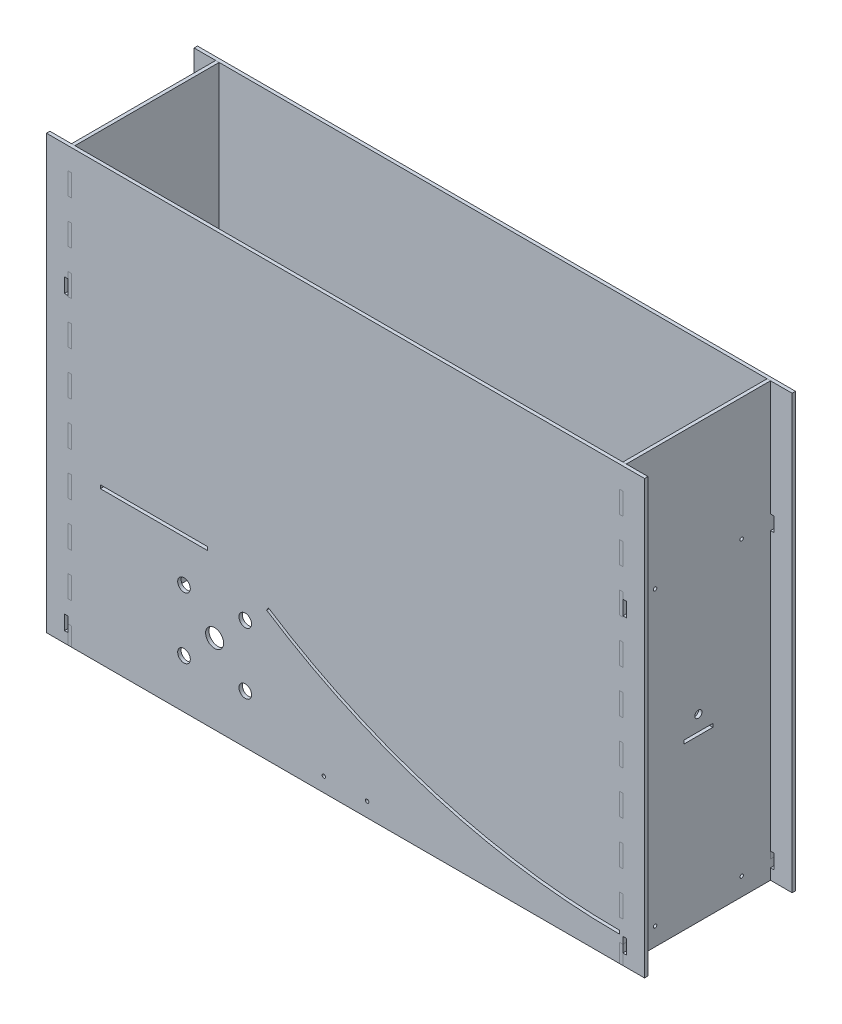
from build123d import *

# Parameters (mm, degrees)
SKETCH1_W                      = 488.5944
SKETCH1_H                      = 132.9944
SKETCH1_W_2                    = 482.6
SKETCH1_H_2                    = 127
BASE_EXTRUDE_DEPTH             = 2.9972
SKETCH1_3_W                    = 488.5944
SKETCH1_3_H                    = 132.9944
SKETCH1_3_W_2                  = 482.6
SKETCH1_3_H_2                  = 127
WALL_EXTRUDE_DEPTH             = 383.9972
WHEELRAMP_R                    = 7.937499998
WHEELRAMP_R_2                  = 5.556249998
WHEELRAMP_W                    = 94.294688084
WHEELRAMP_H                    = 2.9972
CUT_EXTRUDE9_DEPTH             = 475.154491666
SKETCH19_W                     = 25.4
SKETCH19_H                     = 2.9972
SKETCH19_R                     = 3.175
SIDE_CUTS_DEPTH                = 625.980171627
SKETCH23_W                     = 19.05
SKETCH23_H                     = 383.9972
BOSS_EXTRUDE1_DEPTH            = 2.9972
BOSS_EXTRUDE2_START            = -132.9944
SKETCH23_2_W                   = 19.05
SKETCH23_2_H                   = 383.9972
BOSS_EXTRUDE2_DEPTH            = 2.9972
SKETCH21_W                     = 12.827
SKETCH21_H                     = 6.477
SKETCH21_W_2                   = 6.477
SKETCH21_H_2                   = 12.827
SKETCH21_W_3                   = 3.175
BOTTOM_SUPPORT_HOLES_DEPTH     = 471.348248603
SPLIT1_START                   = -244.2972
SPLIT1_OUTLINE_W               = 2.9972
SPLIT1_OUTLINE_H               = 25.4
SPLIT1_OUTLINE_R               = 3.175
SPLIT1_DEPTH                   = 2.9972
SPLIT1_START_2                 = 2.9972
SPLIT1_2_OUTLINE_W             = 2.9972
SPLIT1_2_OUTLINE_H             = 127
SPLIT1_2_DEPTH                 = 381
SPLIT1_3_OUTLINE_W             = 2.9972
SPLIT1_3_OUTLINE_H             = 12.0904
SPLIT1_3_DEPTH                 = 19.19986
SPLIT1_START_3                 = 38.39972
SPLIT1_4_OUTLINE_W             = 2.9972
SPLIT1_4_OUTLINE_H             = 2.9972
SPLIT1_4_DEPTH                 = 19.19986
SPLIT1_START_4                 = 76.79944
SPLIT1_5_OUTLINE_W             = 2.9972
SPLIT1_5_OUTLINE_H             = 2.9972
SPLIT1_5_DEPTH                 = 19.19986
SPLIT1_START_5                 = 115.19916
SPLIT1_6_OUTLINE_W             = 2.9972
SPLIT1_6_OUTLINE_H             = 2.9972
SPLIT1_6_DEPTH                 = 19.19986
SPLIT1_START_6                 = 153.59888
SPLIT1_7_OUTLINE_W             = 2.9972
SPLIT1_7_OUTLINE_H             = 2.9972
SPLIT1_7_DEPTH                 = 19.19986
SPLIT1_START_7                 = 191.9986
SPLIT1_8_OUTLINE_W             = 2.9972
SPLIT1_8_OUTLINE_H             = 2.9972
SPLIT1_8_DEPTH                 = 19.19986
SPLIT1_START_8                 = 230.39832
SPLIT1_9_OUTLINE_W             = 2.9972
SPLIT1_9_OUTLINE_H             = 2.9972
SPLIT1_9_DEPTH                 = 19.19986
SPLIT1_START_9                 = 268.79804
SPLIT1_10_OUTLINE_W            = 2.9972
SPLIT1_10_OUTLINE_H            = 2.9972
SPLIT1_10_DEPTH                = 19.19986
SPLIT1_START_10                = 307.19776
SPLIT1_11_OUTLINE_W            = 2.9972
SPLIT1_11_OUTLINE_H            = 2.9972
SPLIT1_11_DEPTH                = 19.19986
SPLIT1_START_11                = 345.59748
SPLIT1_12_OUTLINE_W            = 2.9972
SPLIT1_12_OUTLINE_H            = 2.9972
SPLIT1_12_DEPTH                = 19.19986
SPLIT2_START                   = 241.3
SPLIT2_OUTLINE_W               = 2.9972
SPLIT2_OUTLINE_H               = 25.4
SPLIT2_OUTLINE_R               = 3.175
SPLIT2_DEPTH                   = 2.9972
SPLIT2_START_2                 = 2.9972
SPLIT2_2_OUTLINE_W             = 2.9972
SPLIT2_2_OUTLINE_H             = 127
SPLIT2_2_DEPTH                 = 381
SPLIT2_3_OUTLINE_W             = 2.9972
SPLIT2_3_OUTLINE_H             = 12.0904
SPLIT2_3_DEPTH                 = 19.19986
SPLIT2_START_3                 = 38.39972
SPLIT2_4_OUTLINE_W             = 2.9972
SPLIT2_4_OUTLINE_H             = 2.9972
SPLIT2_4_DEPTH                 = 19.19986
SPLIT2_START_4                 = 76.79944
SPLIT2_5_OUTLINE_W             = 2.9972
SPLIT2_5_OUTLINE_H             = 2.9972
SPLIT2_5_DEPTH                 = 19.19986
SPLIT2_START_5                 = 115.19916
SPLIT2_6_OUTLINE_W             = 2.9972
SPLIT2_6_OUTLINE_H             = 2.9972
SPLIT2_6_DEPTH                 = 19.19986
SPLIT2_START_6                 = 153.59888
SPLIT2_7_OUTLINE_W             = 2.9972
SPLIT2_7_OUTLINE_H             = 2.9972
SPLIT2_7_DEPTH                 = 19.19986
SPLIT2_START_7                 = 191.9986
SPLIT2_8_OUTLINE_W             = 2.9972
SPLIT2_8_OUTLINE_H             = 2.9972
SPLIT2_8_DEPTH                 = 19.19986
SPLIT2_START_8                 = 230.39832
SPLIT2_9_OUTLINE_W             = 2.9972
SPLIT2_9_OUTLINE_H             = 2.9972
SPLIT2_9_DEPTH                 = 19.19986
SPLIT2_START_9                 = 268.79804
SPLIT2_10_OUTLINE_W            = 2.9972
SPLIT2_10_OUTLINE_H            = 2.9972
SPLIT2_10_DEPTH                = 19.19986
SPLIT2_START_10                = 307.19776
SPLIT2_11_OUTLINE_W            = 2.9972
SPLIT2_11_OUTLINE_H            = 2.9972
SPLIT2_11_DEPTH                = 19.19986
SPLIT2_START_11                = 345.59748
SPLIT2_12_OUTLINE_W            = 2.9972
SPLIT2_12_OUTLINE_H            = 2.9972
SPLIT2_12_DEPTH                = 19.19986
SKETCH22_W                     = 526.6944
SKETCH22_H                     = 2.9972
CUT_EXTRUDE5_DEPTH             = 485.24488411
SKETCH26_R                     = 1.5
SKETCH26_W                     = 3.175
SKETCH26_H                     = 12.7
FRONT_BACK_SUPPORT_HOLES_DEPTH = 485.24488411
SKETCH27_R                     = 1.5
SIDE_SUPPORT_HOLES_DEPTH       = 640.983252958


# Read off the part's stored shape, not the designer's step: Split1, Split2
with BuildPart() as part:
    # Sketch1 → Base Extrude (new body)
    # profile 1 of 2: a face of its own
    with BuildSketch(Plane(origin=(0, 0, 0), x_dir=(1, 0, 0), z_dir=(0, 1, 0))):
        Rectangle(SKETCH1_W, SKETCH1_H)
        Rectangle(SKETCH1_W_2, SKETCH1_H_2, mode=Mode.SUBTRACT)
    # profile 2 of 2: a face of its own
    with BuildSketch(Plane(origin=(0, 0, 0), x_dir=(1, 0, 0), z_dir=(0, 1, 0))):
        Rectangle(SKETCH1_W_2, SKETCH1_H_2)
    extrude(amount=BASE_EXTRUDE_DEPTH)

    # Sketch1<3> → Wall Extrude (add)
    with BuildSketch(Plane(origin=(0, 0, 0), x_dir=(1, 0, 0), z_dir=(0, 1, 0))):
        Rectangle(SKETCH1_3_W, SKETCH1_3_H)
        Rectangle(SKETCH1_3_W_2, SKETCH1_3_H_2, mode=Mode.SUBTRACT)
    extrude(amount=WALL_EXTRUDE_DEPTH)

    # WheelRamp → Cut-Extrude9 (cut, through all)
    with BuildSketch(Plane.XY.offset(66.4972)):
        with Locations((-115.255311916, 72.974199998)):
            Circle(WHEELRAMP_R)
        with Locations((-142.242811916, 99.961699998)):
            Circle(WHEELRAMP_R_2)
        with Locations((-88.267811916, 99.961699998)):
            Circle(WHEELRAMP_R_2)
        with Locations((-88.267811916, 45.986699998)):
            Circle(WHEELRAMP_R_2)
        with Locations((-142.242811916, 45.986699998)):
            Circle(WHEELRAMP_R_2)
        with Locations((-168.752655958, 138.099799997)):
            Rectangle(WHEELRAMP_W, WHEELRAMP_H)
        with BuildLine():
            ThreePointArc((241.3, 25.4), (79.286857825, 48.817031678), (-69.464743824, 117.151332121))
            Line((-69.464743824, 117.151332121), (-67.836837693, 119.667903095))
            ThreePointArc((-67.836837693, 119.667903095), (80.135545434, 51.691564193), (241.3, 28.3972))
            Line((241.3, 28.3972), (241.3, 25.4))
        make_face()
    extrude(amount=-CUT_EXTRUDE9_DEPTH, mode=Mode.SUBTRACT)

    # Sketch19 → Side Cuts (cut, through all)
    with BuildSketch(Plane.ZY.offset(244.2972)):
        with Locations((0, 146.5326)):
            Rectangle(SKETCH19_W, SKETCH19_H)
        with Locations((0, 161.4932)):
            Circle(SKETCH19_R)
    extrude(amount=-SIDE_CUTS_DEPTH, mode=Mode.SUBTRACT)

    # Sketch23 → Boss-Extrude1 (add)
    with BuildSketch(Plane.XY.offset(66.4972)):
        with Locations((-253.8222, 191.9986)):
            Rectangle(SKETCH23_W, SKETCH23_H)
        with Locations((253.8222, 191.9986)):
            Rectangle(SKETCH23_W, SKETCH23_H)
    extrude(amount=-BOSS_EXTRUDE1_DEPTH)

    # Sketch23<2> → Boss-Extrude2 (add)
    with BuildSketch(Plane.XY.offset(66.4972).offset(BOSS_EXTRUDE2_START)):
        with Locations((-253.8222, 191.9986)):
            Rectangle(SKETCH23_2_W, SKETCH23_2_H)
        with Locations((253.8222, 191.9986)):
            Rectangle(SKETCH23_2_W, SKETCH23_2_H)
    extrude(amount=BOSS_EXTRUDE2_DEPTH)

    # Sketch21 → Bottom Support Holes (cut, through all)
    with BuildSketch(Plane.XZ):
        with Locations((0, 50.5587)):
            Rectangle(SKETCH21_W, SKETCH21_H)
        with Locations((-228.3587, 0)):
            Rectangle(SKETCH21_W_2, SKETCH21_H_2)
        with Locations((0, -50.5587)):
            Rectangle(SKETCH21_W, SKETCH21_H)
        with Locations((230.0097, 0)):
            Rectangle(SKETCH21_W_3, SKETCH21_H_2)
    extrude(amount=-BOTTOM_SUPPORT_HOLES_DEPTH, mode=Mode.SUBTRACT)

    # Split1 2 outline → Split1 2 (cut)
    with BuildSketch(Plane(origin=(0, 0, 0), x_dir=(1, 0, 0), z_dir=(0, 1, 0)).offset(SPLIT1_START_2)):
        with Locations((-242.7986, 0)):
            Rectangle(SPLIT1_2_OUTLINE_W, SPLIT1_2_OUTLINE_H)
    extrude(amount=SPLIT1_2_DEPTH, mode=Mode.SUBTRACT)

    # Split1 3 outline → Split1 3 (cut)
    with BuildSketch(Plane(origin=(0, 0, 0), x_dir=(1, 0, 0), z_dir=(0, 1, 0))):
        with Locations((-242.7986, 60.452)):
            Rectangle(SPLIT1_3_OUTLINE_W, SPLIT1_3_OUTLINE_H)
        with Locations((-242.7986, 36.2712)):
            Rectangle(SPLIT1_3_OUTLINE_W, SPLIT1_3_OUTLINE_H)
        with Locations((-242.7986, 12.0904)):
            Rectangle(SPLIT1_3_OUTLINE_W, SPLIT1_3_OUTLINE_H)
        with Locations((-242.7986, -12.0904)):
            Rectangle(SPLIT1_3_OUTLINE_W, SPLIT1_3_OUTLINE_H)
        with Locations((-242.7986, -36.2712)):
            Rectangle(SPLIT1_3_OUTLINE_W, SPLIT1_3_OUTLINE_H)
        with Locations((-242.7986, -60.452)):
            Rectangle(SPLIT1_3_OUTLINE_W, SPLIT1_3_OUTLINE_H)
    extrude(amount=SPLIT1_3_DEPTH, mode=Mode.SUBTRACT)

    # Split1 4 outline → Split1 4 (cut)
    with BuildSketch(Plane(origin=(0, 0, 0), x_dir=(1, 0, 0), z_dir=(0, 1, 0)).offset(SPLIT1_START_3)):
        with Locations((-242.7986, 64.9986)):
            Rectangle(SPLIT1_4_OUTLINE_W, SPLIT1_4_OUTLINE_H)
        with Locations((-242.7986, -64.9986)):
            Rectangle(SPLIT1_4_OUTLINE_W, SPLIT1_4_OUTLINE_H)
    extrude(amount=SPLIT1_4_DEPTH, mode=Mode.SUBTRACT)

    # Split1 5 outline → Split1 5 (cut)
    with BuildSketch(Plane(origin=(0, 0, 0), x_dir=(1, 0, 0), z_dir=(0, 1, 0)).offset(SPLIT1_START_4)):
        with Locations((-242.7986, 64.9986)):
            Rectangle(SPLIT1_5_OUTLINE_W, SPLIT1_5_OUTLINE_H)
        with Locations((-242.7986, -64.9986)):
            Rectangle(SPLIT1_5_OUTLINE_W, SPLIT1_5_OUTLINE_H)
    extrude(amount=SPLIT1_5_DEPTH, mode=Mode.SUBTRACT)

    # Split1 6 outline → Split1 6 (cut)
    with BuildSketch(Plane(origin=(0, 0, 0), x_dir=(1, 0, 0), z_dir=(0, 1, 0)).offset(SPLIT1_START_5)):
        with Locations((-242.7986, 64.9986)):
            Rectangle(SPLIT1_6_OUTLINE_W, SPLIT1_6_OUTLINE_H)
        with Locations((-242.7986, -64.9986)):
            Rectangle(SPLIT1_6_OUTLINE_W, SPLIT1_6_OUTLINE_H)
    extrude(amount=SPLIT1_6_DEPTH, mode=Mode.SUBTRACT)

    # Split1 7 outline → Split1 7 (cut)
    with BuildSketch(Plane(origin=(0, 0, 0), x_dir=(1, 0, 0), z_dir=(0, 1, 0)).offset(SPLIT1_START_6)):
        with Locations((-242.7986, 64.9986)):
            Rectangle(SPLIT1_7_OUTLINE_W, SPLIT1_7_OUTLINE_H)
        with Locations((-242.7986, -64.9986)):
            Rectangle(SPLIT1_7_OUTLINE_W, SPLIT1_7_OUTLINE_H)
    extrude(amount=SPLIT1_7_DEPTH, mode=Mode.SUBTRACT)

    # Split1 8 outline → Split1 8 (cut)
    with BuildSketch(Plane(origin=(0, 0, 0), x_dir=(1, 0, 0), z_dir=(0, 1, 0)).offset(SPLIT1_START_7)):
        with Locations((-242.7986, 64.9986)):
            Rectangle(SPLIT1_8_OUTLINE_W, SPLIT1_8_OUTLINE_H)
        with Locations((-242.7986, -64.9986)):
            Rectangle(SPLIT1_8_OUTLINE_W, SPLIT1_8_OUTLINE_H)
    extrude(amount=SPLIT1_8_DEPTH, mode=Mode.SUBTRACT)

    # Split1 9 outline → Split1 9 (cut)
    with BuildSketch(Plane(origin=(0, 0, 0), x_dir=(1, 0, 0), z_dir=(0, 1, 0)).offset(SPLIT1_START_8)):
        with Locations((-242.7986, 64.9986)):
            Rectangle(SPLIT1_9_OUTLINE_W, SPLIT1_9_OUTLINE_H)
        with Locations((-242.7986, -64.9986)):
            Rectangle(SPLIT1_9_OUTLINE_W, SPLIT1_9_OUTLINE_H)
    extrude(amount=SPLIT1_9_DEPTH, mode=Mode.SUBTRACT)

    # Split1 10 outline → Split1 10 (cut)
    with BuildSketch(Plane(origin=(0, 0, 0), x_dir=(1, 0, 0), z_dir=(0, 1, 0)).offset(SPLIT1_START_9)):
        with Locations((-242.7986, 64.9986)):
            Rectangle(SPLIT1_10_OUTLINE_W, SPLIT1_10_OUTLINE_H)
        with Locations((-242.7986, -64.9986)):
            Rectangle(SPLIT1_10_OUTLINE_W, SPLIT1_10_OUTLINE_H)
    extrude(amount=SPLIT1_10_DEPTH, mode=Mode.SUBTRACT)

    # Split1 11 outline → Split1 11 (cut)
    with BuildSketch(Plane(origin=(0, 0, 0), x_dir=(1, 0, 0), z_dir=(0, 1, 0)).offset(SPLIT1_START_10)):
        with Locations((-242.7986, 64.9986)):
            Rectangle(SPLIT1_11_OUTLINE_W, SPLIT1_11_OUTLINE_H)
        with Locations((-242.7986, -64.9986)):
            Rectangle(SPLIT1_11_OUTLINE_W, SPLIT1_11_OUTLINE_H)
    extrude(amount=SPLIT1_11_DEPTH, mode=Mode.SUBTRACT)

    # Split1 12 outline → Split1 12 (cut)
    with BuildSketch(Plane(origin=(0, 0, 0), x_dir=(1, 0, 0), z_dir=(0, 1, 0)).offset(SPLIT1_START_11)):
        with Locations((-242.7986, 64.9986)):
            Rectangle(SPLIT1_12_OUTLINE_W, SPLIT1_12_OUTLINE_H)
        with Locations((-242.7986, -64.9986)):
            Rectangle(SPLIT1_12_OUTLINE_W, SPLIT1_12_OUTLINE_H)
    extrude(amount=SPLIT1_12_DEPTH, mode=Mode.SUBTRACT)

    # Split2 2 outline → Split2 2 (cut)
    with BuildSketch(Plane(origin=(0, 0, 0), x_dir=(1, 0, 0), z_dir=(0, 1, 0)).offset(SPLIT2_START_2)):
        with Locations((242.7986, 0)):
            Rectangle(SPLIT2_2_OUTLINE_W, SPLIT2_2_OUTLINE_H)
    extrude(amount=SPLIT2_2_DEPTH, mode=Mode.SUBTRACT)

    # Split2 3 outline → Split2 3 (cut)
    with BuildSketch(Plane(origin=(0, 0, 0), x_dir=(1, 0, 0), z_dir=(0, 1, 0))):
        with Locations((242.7986, 60.452)):
            Rectangle(SPLIT2_3_OUTLINE_W, SPLIT2_3_OUTLINE_H)
        with Locations((242.7986, 36.2712)):
            Rectangle(SPLIT2_3_OUTLINE_W, SPLIT2_3_OUTLINE_H)
        with Locations((242.7986, 12.0904)):
            Rectangle(SPLIT2_3_OUTLINE_W, SPLIT2_3_OUTLINE_H)
        with Locations((242.7986, -12.0904)):
            Rectangle(SPLIT2_3_OUTLINE_W, SPLIT2_3_OUTLINE_H)
        with Locations((242.7986, -36.2712)):
            Rectangle(SPLIT2_3_OUTLINE_W, SPLIT2_3_OUTLINE_H)
        with Locations((242.7986, -60.452)):
            Rectangle(SPLIT2_3_OUTLINE_W, SPLIT2_3_OUTLINE_H)
    extrude(amount=SPLIT2_3_DEPTH, mode=Mode.SUBTRACT)

    # Split2 4 outline → Split2 4 (cut)
    with BuildSketch(Plane(origin=(0, 0, 0), x_dir=(1, 0, 0), z_dir=(0, 1, 0)).offset(SPLIT2_START_3)):
        with Locations((242.7986, 64.9986)):
            Rectangle(SPLIT2_4_OUTLINE_W, SPLIT2_4_OUTLINE_H)
        with Locations((242.7986, -64.9986)):
            Rectangle(SPLIT2_4_OUTLINE_W, SPLIT2_4_OUTLINE_H)
    extrude(amount=SPLIT2_4_DEPTH, mode=Mode.SUBTRACT)

    # Split2 5 outline → Split2 5 (cut)
    with BuildSketch(Plane(origin=(0, 0, 0), x_dir=(1, 0, 0), z_dir=(0, 1, 0)).offset(SPLIT2_START_4)):
        with Locations((242.7986, 64.9986)):
            Rectangle(SPLIT2_5_OUTLINE_W, SPLIT2_5_OUTLINE_H)
        with Locations((242.7986, -64.9986)):
            Rectangle(SPLIT2_5_OUTLINE_W, SPLIT2_5_OUTLINE_H)
    extrude(amount=SPLIT2_5_DEPTH, mode=Mode.SUBTRACT)

    # Split2 6 outline → Split2 6 (cut)
    with BuildSketch(Plane(origin=(0, 0, 0), x_dir=(1, 0, 0), z_dir=(0, 1, 0)).offset(SPLIT2_START_5)):
        with Locations((242.7986, 64.9986)):
            Rectangle(SPLIT2_6_OUTLINE_W, SPLIT2_6_OUTLINE_H)
        with Locations((242.7986, -64.9986)):
            Rectangle(SPLIT2_6_OUTLINE_W, SPLIT2_6_OUTLINE_H)
    extrude(amount=SPLIT2_6_DEPTH, mode=Mode.SUBTRACT)

    # Split2 7 outline → Split2 7 (cut)
    with BuildSketch(Plane(origin=(0, 0, 0), x_dir=(1, 0, 0), z_dir=(0, 1, 0)).offset(SPLIT2_START_6)):
        with Locations((242.7986, 64.9986)):
            Rectangle(SPLIT2_7_OUTLINE_W, SPLIT2_7_OUTLINE_H)
        with Locations((242.7986, -64.9986)):
            Rectangle(SPLIT2_7_OUTLINE_W, SPLIT2_7_OUTLINE_H)
    extrude(amount=SPLIT2_7_DEPTH, mode=Mode.SUBTRACT)

    # Split2 8 outline → Split2 8 (cut)
    with BuildSketch(Plane(origin=(0, 0, 0), x_dir=(1, 0, 0), z_dir=(0, 1, 0)).offset(SPLIT2_START_7)):
        with Locations((242.7986, 64.9986)):
            Rectangle(SPLIT2_8_OUTLINE_W, SPLIT2_8_OUTLINE_H)
        with Locations((242.7986, -64.9986)):
            Rectangle(SPLIT2_8_OUTLINE_W, SPLIT2_8_OUTLINE_H)
    extrude(amount=SPLIT2_8_DEPTH, mode=Mode.SUBTRACT)

    # Split2 9 outline → Split2 9 (cut)
    with BuildSketch(Plane(origin=(0, 0, 0), x_dir=(1, 0, 0), z_dir=(0, 1, 0)).offset(SPLIT2_START_8)):
        with Locations((242.7986, 64.9986)):
            Rectangle(SPLIT2_9_OUTLINE_W, SPLIT2_9_OUTLINE_H)
        with Locations((242.7986, -64.9986)):
            Rectangle(SPLIT2_9_OUTLINE_W, SPLIT2_9_OUTLINE_H)
    extrude(amount=SPLIT2_9_DEPTH, mode=Mode.SUBTRACT)

    # Split2 10 outline → Split2 10 (cut)
    with BuildSketch(Plane(origin=(0, 0, 0), x_dir=(1, 0, 0), z_dir=(0, 1, 0)).offset(SPLIT2_START_9)):
        with Locations((242.7986, 64.9986)):
            Rectangle(SPLIT2_10_OUTLINE_W, SPLIT2_10_OUTLINE_H)
        with Locations((242.7986, -64.9986)):
            Rectangle(SPLIT2_10_OUTLINE_W, SPLIT2_10_OUTLINE_H)
    extrude(amount=SPLIT2_10_DEPTH, mode=Mode.SUBTRACT)

    # Split2 11 outline → Split2 11 (cut)
    with BuildSketch(Plane(origin=(0, 0, 0), x_dir=(1, 0, 0), z_dir=(0, 1, 0)).offset(SPLIT2_START_10)):
        with Locations((242.7986, 64.9986)):
            Rectangle(SPLIT2_11_OUTLINE_W, SPLIT2_11_OUTLINE_H)
        with Locations((242.7986, -64.9986)):
            Rectangle(SPLIT2_11_OUTLINE_W, SPLIT2_11_OUTLINE_H)
    extrude(amount=SPLIT2_11_DEPTH, mode=Mode.SUBTRACT)

    # Split2 12 outline → Split2 12 (cut)
    with BuildSketch(Plane(origin=(0, 0, 0), x_dir=(1, 0, 0), z_dir=(0, 1, 0)).offset(SPLIT2_START_11)):
        with Locations((242.7986, 64.9986)):
            Rectangle(SPLIT2_12_OUTLINE_W, SPLIT2_12_OUTLINE_H)
        with Locations((242.7986, -64.9986)):
            Rectangle(SPLIT2_12_OUTLINE_W, SPLIT2_12_OUTLINE_H)
    extrude(amount=SPLIT2_12_DEPTH, mode=Mode.SUBTRACT)


with BuildPart() as body_2:
    # Split1 outline → Split1 (new body)
    with BuildSketch(Plane.YZ.offset(SPLIT1_START)):
        Polygon((38.39972, 63.5), (19.19986, 63.5), (19.19986, 66.4972), (0, 66.4972), (0, 54.4068), (2.9972, 54.4068), (2.9972, 42.3164), (0, 42.3164), (0, 30.226), (2.9972, 30.226), (2.9972, 18.1356), (0, 18.1356), (0, 6.0452), (2.9972, 6.0452), (2.9972, -6.0452), (0, -6.0452), (0, -18.1356), (2.9972, -18.1356), (2.9972, -30.226), (0, -30.226), (0, -42.3164), (2.9972, -42.3164), (2.9972, -54.4068), (0, -54.4068), (0, -66.4972), (19.19986, -66.4972), (19.19986, -63.5), (38.39972, -63.5), (38.39972, -66.4972), (57.59958, -66.4972), (57.59958, -63.5), (76.79944, -63.5), (76.79944, -66.4972), (95.9993, -66.4972), (95.9993, -63.5), (115.19916, -63.5), (115.19916, -66.4972), (134.39902, -66.4972), (134.39902, -63.5), (153.59888, -63.5), (153.59888, -66.4972), (172.79874, -66.4972), (172.79874, -63.5), (191.9986, -63.5), (191.9986, -66.4972), (211.19846, -66.4972), (211.19846, -63.5), (230.39832, -63.5), (230.39832, -66.4972), (249.59818, -66.4972), (249.59818, -63.5), (268.79804, -63.5), (268.79804, -66.4972), (287.9979, -66.4972), (287.9979, -63.5), (307.19776, -63.5), (307.19776, -66.4972), (326.39762, -66.4972), (326.39762, -63.5), (345.59748, -63.5), (345.59748, -66.4972), (364.79734, -66.4972), (364.79734, -63.5), (383.9972, -63.5), (383.9972, 63.5), (364.79734, 63.5), (364.79734, 66.4972), (345.59748, 66.4972), (345.59748, 63.5), (326.39762, 63.5), (326.39762, 66.4972), (307.19776, 66.4972), (307.19776, 63.5), (287.9979, 63.5), (287.9979, 66.4972), (268.79804, 66.4972), (268.79804, 63.5), (249.59818, 63.5), (249.59818, 66.4972), (230.39832, 66.4972), (230.39832, 63.5), (211.19846, 63.5), (211.19846, 66.4972), (191.9986, 66.4972), (191.9986, 63.5), (172.79874, 63.5), (172.79874, 66.4972), (153.59888, 66.4972), (153.59888, 63.5), (134.39902, 63.5), (134.39902, 66.4972), (115.19916, 66.4972), (115.19916, 63.5), (95.9993, 63.5), (95.9993, 66.4972), (76.79944, 66.4972), (76.79944, 63.5), (57.59958, 63.5), (57.59958, 66.4972), (38.39972, 66.4972), align=None)
        with Locations((146.5326, 0)):
            Rectangle(SPLIT1_OUTLINE_W, SPLIT1_OUTLINE_H, mode=Mode.SUBTRACT)
        with Locations((161.4932, 0)):
            Circle(SPLIT1_OUTLINE_R, mode=Mode.SUBTRACT)
    extrude(amount=SPLIT1_DEPTH)


with BuildPart() as body_3:
    # Split2 outline → Split2 (new body)
    with BuildSketch(Plane.YZ.offset(SPLIT2_START)):
        Polygon((383.9972, 63.5), (364.79734, 63.5), (364.79734, 66.4972), (345.59748, 66.4972), (345.59748, 63.5), (326.39762, 63.5), (326.39762, 66.4972), (307.19776, 66.4972), (307.19776, 63.5), (287.9979, 63.5), (287.9979, 66.4972), (268.79804, 66.4972), (268.79804, 63.5), (249.59818, 63.5), (249.59818, 66.4972), (230.39832, 66.4972), (230.39832, 63.5), (211.19846, 63.5), (211.19846, 66.4972), (191.9986, 66.4972), (191.9986, 63.5), (172.79874, 63.5), (172.79874, 66.4972), (153.59888, 66.4972), (153.59888, 63.5), (134.39902, 63.5), (134.39902, 66.4972), (115.19916, 66.4972), (115.19916, 63.5), (95.9993, 63.5), (95.9993, 66.4972), (76.79944, 66.4972), (76.79944, 63.5), (57.59958, 63.5), (57.59958, 66.4972), (38.39972, 66.4972), (38.39972, 63.5), (19.19986, 63.5), (19.19986, 66.4972), (0, 66.4972), (0, 54.4068), (2.9972, 54.4068), (2.9972, 42.3164), (0, 42.3164), (0, 30.226), (2.9972, 30.226), (2.9972, 18.1356), (0, 18.1356), (0, 6.0452), (2.9972, 6.0452), (2.9972, -6.0452), (0, -6.0452), (0, -18.1356), (2.9972, -18.1356), (2.9972, -30.226), (0, -30.226), (0, -42.3164), (2.9972, -42.3164), (2.9972, -54.4068), (0, -54.4068), (0, -66.4972), (19.19986, -66.4972), (19.19986, -63.5), (38.39972, -63.5), (38.39972, -66.4972), (57.59958, -66.4972), (57.59958, -63.5), (76.79944, -63.5), (76.79944, -66.4972), (95.9993, -66.4972), (95.9993, -63.5), (115.19916, -63.5), (115.19916, -66.4972), (134.39902, -66.4972), (134.39902, -63.5), (153.59888, -63.5), (153.59888, -66.4972), (172.79874, -66.4972), (172.79874, -63.5), (191.9986, -63.5), (191.9986, -66.4972), (211.19846, -66.4972), (211.19846, -63.5), (230.39832, -63.5), (230.39832, -66.4972), (249.59818, -66.4972), (249.59818, -63.5), (268.79804, -63.5), (268.79804, -66.4972), (287.9979, -66.4972), (287.9979, -63.5), (307.19776, -63.5), (307.19776, -66.4972), (326.39762, -66.4972), (326.39762, -63.5), (345.59748, -63.5), (345.59748, -66.4972), (364.79734, -66.4972), (364.79734, -63.5), (383.9972, -63.5), align=None)
        with Locations((146.5326, 0)):
            Rectangle(SPLIT2_OUTLINE_W, SPLIT2_OUTLINE_H, mode=Mode.SUBTRACT)
        with Locations((161.4932, 0)):
            Circle(SPLIT2_OUTLINE_R, mode=Mode.SUBTRACT)
    extrude(amount=SPLIT2_DEPTH)


with BuildPart() as cut_extrude5_tool:
    # Sketch22 → Cut-Extrude5 (new, through all)
    with BuildSketch(Plane.XY.offset(66.4972)):
        with Locations((0, 1.4986)):
            Rectangle(SKETCH22_W, SKETCH22_H)
    extrude(amount=-CUT_EXTRUDE5_DEPTH)


with BuildPart() as part_1:
    add(part.part)

    # Cut-Extrude5: cut by cut_extrude5_tool
    add(cut_extrude5_tool.part, mode=Mode.SUBTRACT)

    # Sketch26 → Front/Back Support Holes (cut, through all)
    with BuildSketch(Plane.XY.offset(66.4972)):
        with Locations((-19.05, 15.6972)):
            Circle(SKETCH26_R)
        with Locations((19.05, 15.6972)):
            Circle(SKETCH26_R)
        with Locations((245.8847, 18.8722)):
            Rectangle(SKETCH26_W, SKETCH26_H)
        with Locations((-245.8847, 18.8722)):
            Rectangle(SKETCH26_W, SKETCH26_H)
        with Locations((245.8847, 276.0472)):
            Rectangle(SKETCH26_W, SKETCH26_H)
        with Locations((-245.8847, 276.0472)):
            Rectangle(SKETCH26_W, SKETCH26_H)
    extrude(amount=-FRONT_BACK_SUPPORT_HOLES_DEPTH, mode=Mode.SUBTRACT)


with BuildPart() as body_2_1:
    add(body_2.part)

    # Cut-Extrude5: cut by cut_extrude5_tool
    add(cut_extrude5_tool.part, mode=Mode.SUBTRACT)


with BuildPart() as body_3_1:
    add(body_3.part)

    # Cut-Extrude5: cut by cut_extrude5_tool
    add(cut_extrude5_tool.part, mode=Mode.SUBTRACT)


with BuildPart() as side_support_holes_tool:
    # Sketch27 → Side Support Holes (new, through all)
    with BuildSketch(Plane.ZY.offset(244.2972)):
        with Locations((38.1, 18.8722)):
            Circle(SKETCH27_R)
        with Locations((-38.1, 18.8722)):
            Circle(SKETCH27_R)
        with Locations((-38.1, 276.0472)):
            Circle(SKETCH27_R)
        with Locations((38.1, 276.0472)):
            Circle(SKETCH27_R)
    extrude(amount=-SIDE_SUPPORT_HOLES_DEPTH)


with BuildPart() as body_2_2:
    add(body_2_1.part)

    # Side Support Holes: cut by side_support_holes_tool
    add(side_support_holes_tool.part, mode=Mode.SUBTRACT)


with BuildPart() as body_3_2:
    add(body_3_1.part)

    # Side Support Holes: cut by side_support_holes_tool
    add(side_support_holes_tool.part, mode=Mode.SUBTRACT)


solid = Compound([part_1.part, body_2_2.part, body_3_2.part])
